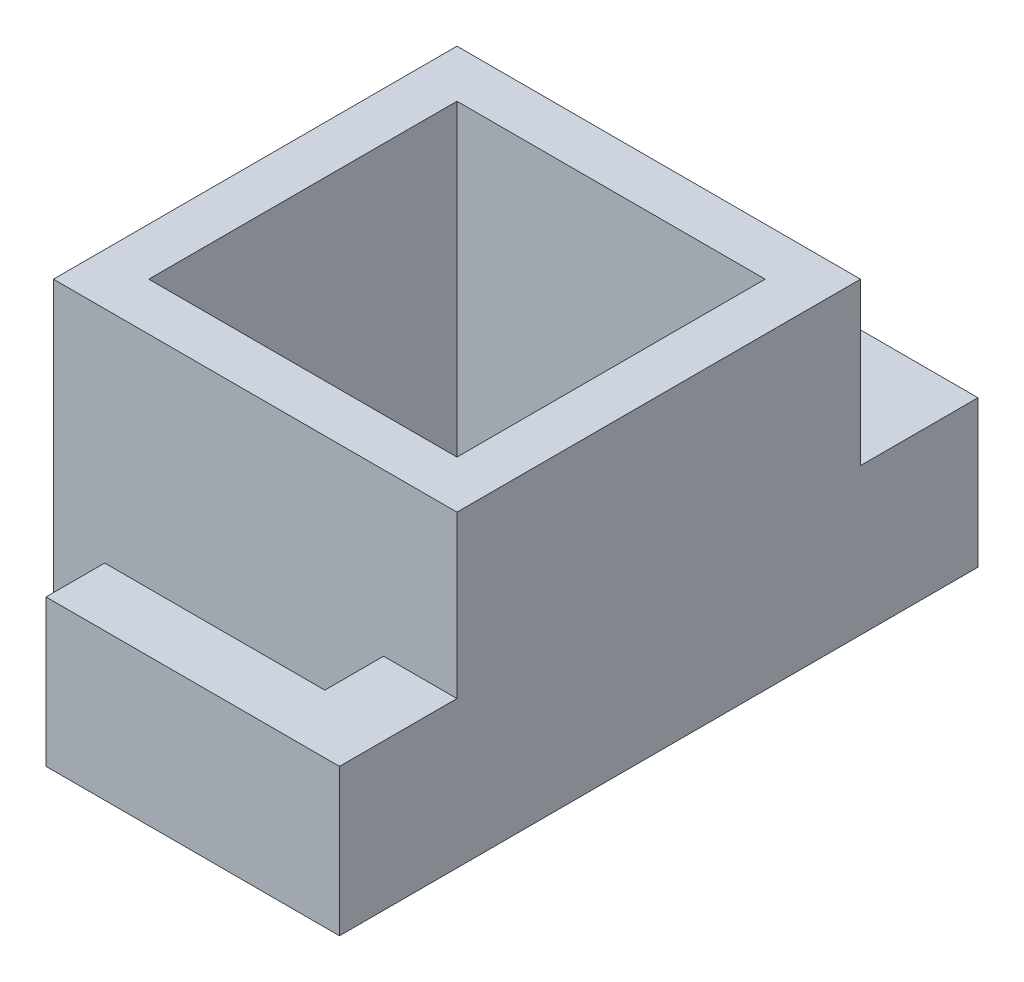
from build123d import *

# Parameters (mm, degrees)
SKETCH1_W           = 55
SKETCH1_H           = 55
SKETCH1_W_2         = 42
SKETCH1_H_2         = 42
BOSS_EXTRUDE1_DEPTH = 42
BOSS_EXTRUDE2_DEPTH = 20


with BuildPart() as part:
    # Sketch1 → Boss-Extrude1 (new body)
    with BuildSketch(Plane(origin=(0, 0, 0), x_dir=(1, 0, 0), z_dir=(0, 1, 0))):
        with Locations((21, 21)):
            Rectangle(SKETCH1_W, SKETCH1_H)
        with Locations((21, 21)):
            Rectangle(SKETCH1_W_2, SKETCH1_H_2, mode=Mode.SUBTRACT)
    extrude(amount=BOSS_EXTRUDE1_DEPTH)

    # Sketch2 → Boss-Extrude2 (add)
    with BuildSketch(Plane.XZ):
        Polygon((38.5, 6.5), (38.5, 14.51), (8.5, 14.51), (8.5, 22.51), (48.5, 22.51), (48.5, 6.5), align=None)
        Polygon((8.5, -56.51), (8.5, -64.51), (48.5, -64.51), (48.5, -48.5), (38.5, -48.5), (38.5, -56.51), align=None)
    extrude(amount=-BOSS_EXTRUDE2_DEPTH)


solid = part.part
